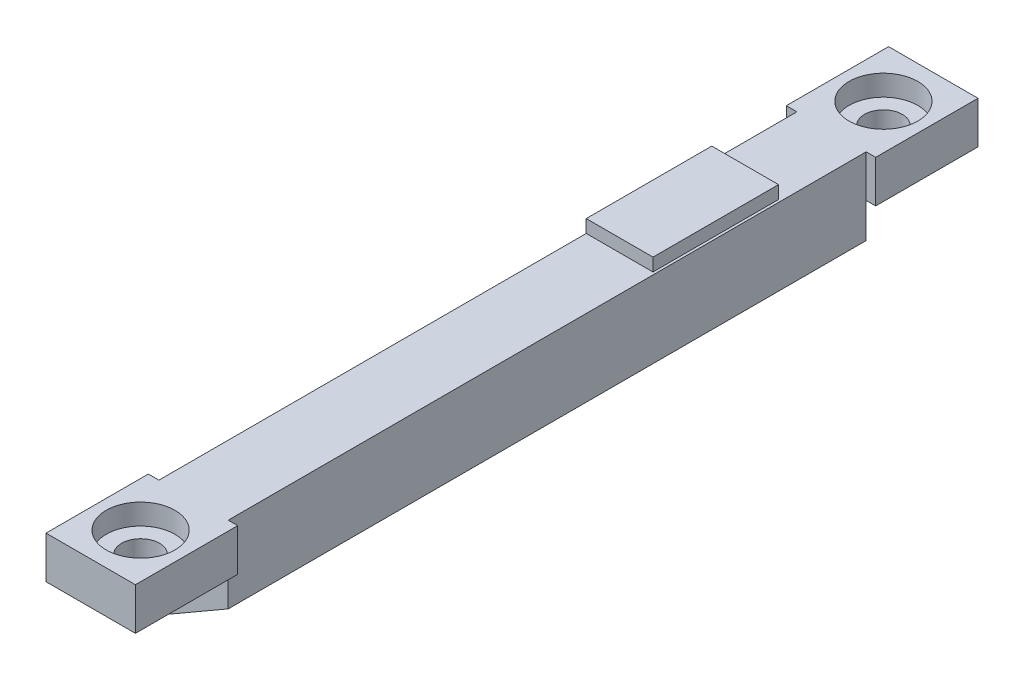
from build123d import *

# Parameters (mm, degrees)
CLAMP_START         = -20.15
CLAMP_X_BASE_DEPTH  = 37.1
EAR_START           = -26.1
SKETCH2_W           = 5.2
SKETCH2_H           = 2.45
EAR_X_BASE_26_DEPTH = 5.95
EAR_START_2         = 16.95
SKETCH3_W           = 5.2
SKETCH3_H           = 2.45
EAR_X_BASE_17_DEPTH = 5.95
CUT_EXTRUDE1_START  = -6.55
SKETCH4_R           = 1.1
CUT_EXTRUDE1_DEPTH  = 2.65
CUT_EXTRUDE2_START  = -5.21
SKETCH5_R           = 2
CUT_EXTRUDE2_DEPTH  = 1.22
BOSS_EXTRUDE4_START = -4
SKETCH6_W           = 3.882851153
SKETCH6_H           = 7.3
BOSS_EXTRUDE4_DEPTH = 0.75


with BuildPart() as part:
    # Sketch1 → Clamp +X base (new body)
    with BuildSketch(Plane.XY.offset(CLAMP_START)):
        Polygon((13.367148847, -4), (17.397275866, -4), (17.397275866, -8.470102587), (13.367148847, -10.796897507), align=None)
    extrude(amount=CLAMP_X_BASE_DEPTH)

    # Sketch2 → Ear +X base -26 (add)
    with BuildSketch(Plane.XY.offset(EAR_START)):
        with Locations((15.35, -5.225)):
            Rectangle(SKETCH2_W, SKETCH2_H)
    extrude(amount=EAR_X_BASE_26_DEPTH)

    # Sketch3 → Ear +X base 17 (add)
    with BuildSketch(Plane.XY.offset(EAR_START_2)):
        with Locations((15.35, -5.225)):
            Rectangle(SKETCH3_W, SKETCH3_H)
    extrude(amount=EAR_X_BASE_17_DEPTH)

    # Sketch4 → Cut-Extrude1 (cut)
    with BuildSketch(Plane(origin=(0, 0, 0), x_dir=(1, 0, 0), z_dir=(0, 1, 0)).offset(CUT_EXTRUDE1_START)):
        with Locations((15.35, 23.2)):
            Circle(SKETCH4_R)
        with Locations((15.35, -20)):
            Circle(SKETCH4_R)
    extrude(amount=CUT_EXTRUDE1_DEPTH, mode=Mode.SUBTRACT)

    # Sketch5 → Cut-Extrude2 (cut)
    with BuildSketch(Plane(origin=(0, 0, 0), x_dir=(1, 0, 0), z_dir=(0, 1, 0)).offset(CUT_EXTRUDE2_START)):
        with Locations((15.35, 23.2)):
            Circle(SKETCH5_R)
        with Locations((15.35, -20)):
            Circle(SKETCH5_R)
    extrude(amount=CUT_EXTRUDE2_DEPTH, mode=Mode.SUBTRACT)

    # Sketch6 → Boss-Extrude4 (add)
    with BuildSketch(Plane(origin=(0, 0, 0), x_dir=(1, 0, 0), z_dir=(0, 1, 0)).offset(BOSS_EXTRUDE4_START)):
        with Locations((15.308574424, 11.55)):
            Rectangle(SKETCH6_W, SKETCH6_H)
    extrude(amount=BOSS_EXTRUDE4_DEPTH)


solid = part.part
